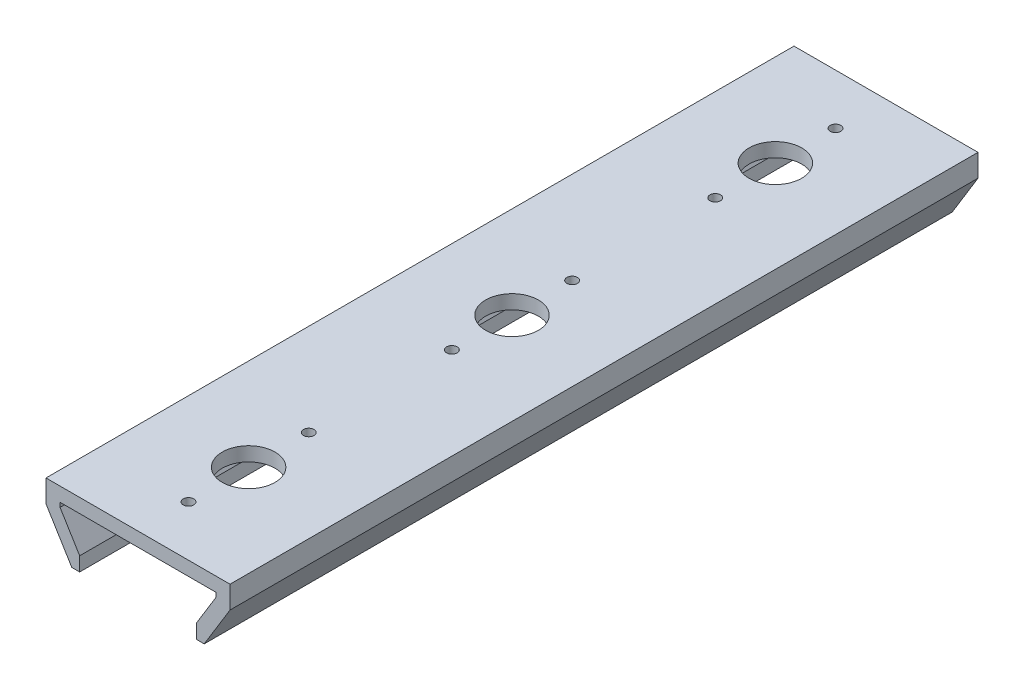
from build123d import *

# Parameters (mm, degrees)
BOSS_EXTRUDE1_DEPTH = 213
SKETCH2_R           = 7.5
CUT_EXTRUDE1_DEPTH  = 213
SKETCH7_R           = 1.5
CUT_EXTRUDE2_DEPTH  = 10
LPATTERN1_COUNT     = 3
LPATTERN1_PITCH     = 75


with BuildPart() as part:
    # Sketch1 → Boss-Extrude1 (new body)
    with BuildSketch(Plane.XY):
        Polygon((-22.2, -13.289354466), (0, -13.289354466), (22.2, -13.289354466), (22.2, -14.545627613), (16.612166923, -23.689354466), (16.612166923, -27.689354466), (18.855505392, -27.689354466), (26.2, -15.671090562), (26.2, -9.289354466), (-26.2, -9.289354466), (-26.2, -15.671090562), (-18.855505392, -27.689354466), (-16.612166923, -27.689354466), (-16.612166923, -23.689354466), (-22.2, -14.545627613), align=None)
    extrude(amount=BOSS_EXTRUDE1_DEPTH)

    # Sketch2 → Cut-Extrude1 (cut)
    with BuildSketch(Plane(origin=(0, -9.289354466, 0), x_dir=(1, 0, 0), z_dir=(0, 1, 0))):
        with Locations((0, -31.5)):
            Circle(SKETCH2_R)
        with Locations((0, -106.5)):
            Circle(SKETCH2_R)
        with Locations((0, -181.5)):
            Circle(SKETCH2_R)
    extrude(amount=-CUT_EXTRUDE1_DEPTH, mode=Mode.SUBTRACT)

    # Sketch7 → Cut-Extrude2 (cut)
    with BuildSketch(Plane(origin=(0, -9.289354466, 0), x_dir=(1, 0, 0), z_dir=(0, 1, 0))):
        with Locations((0, -164.375702269)):
            Circle(SKETCH7_R)
        with Locations((0, -198.624297731)):
            Circle(SKETCH7_R)
    cut_extrude2 = extrude(amount=-CUT_EXTRUDE2_DEPTH, mode=Mode.SUBTRACT)

    # LPattern1: Cut-Extrude2 ×3
    with Locations(*[(0, 0, -i * LPATTERN1_PITCH) for i in range(1, LPATTERN1_COUNT)]):
        add(cut_extrude2, mode=Mode.SUBTRACT)


solid = part.part
